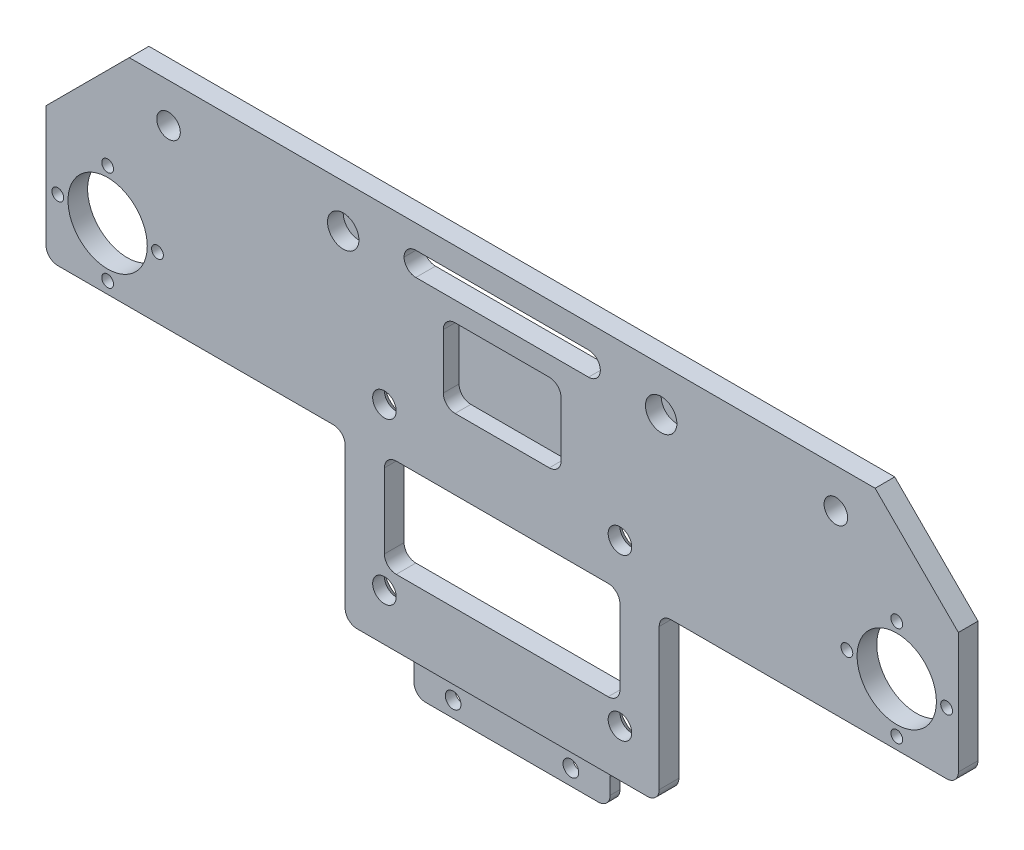
from build123d import *

# Parameters (mm, degrees)
ESQUISSE2_R             = 3
ESQUISSE2_W             = 60
ESQUISSE2_H             = 25
BOSS_EXTRU_2_DEPTH      = 5
ESQUISSE3_W             = 50
ESQUISSE3_H             = 10
ENL_V_MAT_EXTRU_1_DEPTH = 2.5
ESQUISSE4_W             = 50
ESQUISSE4_H             = 6
ENL_V_MAT_EXTRU_2_DEPTH = 159.049070395
ESQUISSE5_W             = 30
ESQUISSE5_H             = 20
ENL_V_MAT_EXTRU_3_DEPTH = 4
CHANFREIN1_SIZE         = 2
ESQUISSE6_R             = 4
ENL_V_MAT_EXTRU_4_DEPTH = 4
ESQUISSE7_R             = 3
ENL_V_MAT_EXTRU_5_DEPTH = 159.049070395
ESQUISSE8_R             = 2
ENL_V_MAT_EXTRU_6_DEPTH = 158.989742239
CONG_2_R                = 3
ESQUISSE9_R             = 10.1
ESQUISSE9_R_2           = 1.5
ENL_V_MAT_EXTRU_7_DEPTH = 159.049070395


with BuildPart() as part:
    # Esquisse2 → Boss.-Extru.2 (new body)
    with BuildSketch(Plane.XY):
        Polygon((-40, 10), (-25, 10), (-25, 0), (25, 0), (25, 10), (40, 10), (40, 52), (116.213203436, 52), (116.213203436, 85.786796564), (95, 107), (-95, 107), (-116.213203436, 85.786796564), (-116.213203436, 52), (-40, 52), align=None)
        with Locations((-30, 63)):
            Circle(ESQUISSE2_R, mode=Mode.SUBTRACT)
        with Locations((-30, 22)):
            Circle(ESQUISSE2_R, mode=Mode.SUBTRACT)
        with Locations((30, 22)):
            Circle(ESQUISSE2_R, mode=Mode.SUBTRACT)
        with Locations((30, 63)):
            Circle(ESQUISSE2_R, mode=Mode.SUBTRACT)
        with Locations((0, 39.5)):
            Rectangle(ESQUISSE2_W, ESQUISSE2_H, mode=Mode.SUBTRACT)
    extrude(amount=BOSS_EXTRU_2_DEPTH)

    # Esquisse3 → Enlèv. mat.-Extru.1 (cut)
    with BuildSketch(Plane.XY.offset(5)):
        with Locations((0, 5)):
            Rectangle(ESQUISSE3_W, ESQUISSE3_H)
    extrude(amount=-ENL_V_MAT_EXTRU_1_DEPTH, mode=Mode.SUBTRACT)

    # Esquisse4 → Enlèv. mat.-Extru.2 (cut, through all)
    with BuildSketch(Plane.XY.offset(5)):
        with Locations((0, 98)):
            Rectangle(ESQUISSE4_W, ESQUISSE4_H)
    extrude(amount=-ENL_V_MAT_EXTRU_2_DEPTH, mode=Mode.SUBTRACT)

    # Esquisse5 → Enlèv. mat.-Extru.3 (cut)
    with BuildSketch(Plane.XY.offset(5)):
        with Locations((0, 80)):
            Rectangle(ESQUISSE5_W, ESQUISSE5_H)
    extrude(amount=-ENL_V_MAT_EXTRU_3_DEPTH, mode=Mode.SUBTRACT)

    # Chanfrein1
    chanfrein1_edges = [part.edges().sort_by_distance(p)[0] for p in [
        (-33, 63, 0),
        (-33, 22, 0),
        (27, 22, 0),
        (27, 63, 0),
    ]]
    chamfer(chanfrein1_edges, length=CHANFREIN1_SIZE - 0.0001)  # a hair under: the kernel refuses the full size

    # Esquisse6 → Enlèv. mat.-Extru.4 (cut)
    with BuildSketch(Plane.XY.offset(5)):
        with Locations((-40.5, 96)):
            Circle(ESQUISSE6_R)
        with Locations((40.5, 96)):
            Circle(ESQUISSE6_R)
    extrude(amount=-ENL_V_MAT_EXTRU_4_DEPTH, mode=Mode.SUBTRACT)

    # Esquisse7 → Enlèv. mat.-Extru.5 (cut, through all)
    with BuildSketch(Plane.XY.offset(5)):
        with Locations((-85, 97)):
            Circle(ESQUISSE7_R)
        with Locations((85, 97)):
            Circle(ESQUISSE7_R)
    extrude(amount=-ENL_V_MAT_EXTRU_5_DEPTH, mode=Mode.SUBTRACT)

    # Esquisse8 → Enlèv. mat.-Extru.6 (cut, through all)
    with BuildSketch(Plane.XY.offset(2.5)):
        with Locations((-15, 4)):
            Circle(ESQUISSE8_R)
        with Locations((15, 4)):
            Circle(ESQUISSE8_R)
    extrude(amount=-ENL_V_MAT_EXTRU_6_DEPTH, mode=Mode.SUBTRACT)

    # Congé2
    cong_2_edges = [part.edges().sort_by_distance(p)[0] for p in [
        (30, 52, 2.5),
        (-30, 27, 2.5),
        (30, 27, 2.5),
        (-25, 95, 2.5),
        (25, 95, 2.5),
        (25, 101, 2.5),
        (-25, 101, 2.5),
        (-30, 52, 2.5),
        (116.213203436, 52, 2.5),
        (-40, 10, 2.5),
        (40, 10, 2.5),
        (-116.213203436, 52, 2.5),
        (-15, 90, 3),
        (-15, 70, 3),
        (15, 70, 3),
        (15, 90, 3),
        (40, 52, 2.5),
        (-40, 52, 2.5),
        (-25, 10, 1.25),
        (25, 10, 1.25),
        (25, 0, 1.25),
        (-25, 0, 1.25),
    ]]
    fillet(cong_2_edges, radius=CONG_2_R - 0.0001)  # a hair under: the kernel refuses the full size

    # Esquisse9 → Enlèv. mat.-Extru.7 (cut, through all)
    with BuildSketch(Plane.XY.offset(5)):
        with Locations((100.513203436, 67.7)):
            Circle(ESQUISSE9_R)
        with Locations((113.213203436, 67.7)):
            Circle(ESQUISSE9_R_2)
        with Locations((100.513203436, 80.4)):
            Circle(ESQUISSE9_R_2)
        with Locations((87.813203436, 67.7)):
            Circle(ESQUISSE9_R_2)
        with Locations((100.513203436, 55)):
            Circle(ESQUISSE9_R_2)
        with Locations((-100.513203436, 67.7)):
            Circle(ESQUISSE9_R)
        with Locations((-87.813203436, 67.7)):
            Circle(ESQUISSE9_R_2)
        with Locations((-100.513203436, 80.4)):
            Circle(ESQUISSE9_R_2)
        with Locations((-113.213203436, 67.7)):
            Circle(ESQUISSE9_R_2)
        with Locations((-100.513203436, 55)):
            Circle(ESQUISSE9_R_2)
    extrude(amount=-ENL_V_MAT_EXTRU_7_DEPTH, mode=Mode.SUBTRACT)


solid = part.part
